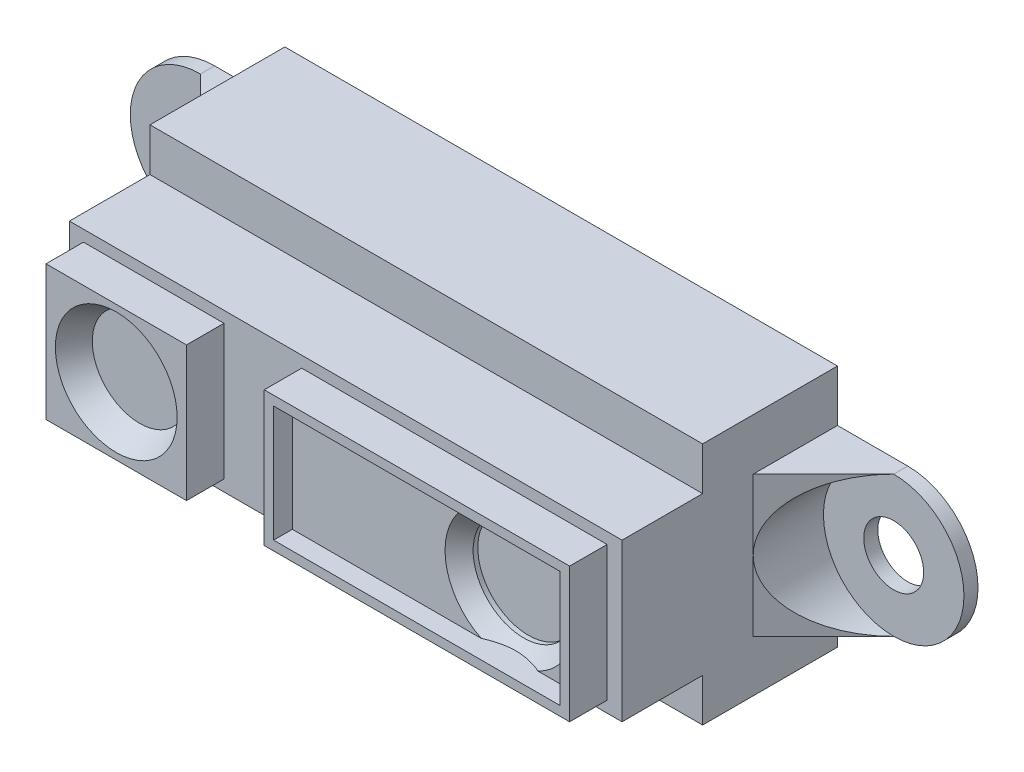
from build123d import *

# Parameters (mm, degrees)
BOSS_EXTRUDE5_DEPTH = 14.75
SKETCH9_W           = 7.5
SKETCH9_H           = 7.2
SKETCH9_W_2         = 16.3
BOSS_EXTRUDE6_DEPTH = 2
SKETCH10_W          = 15.3
SKETCH10_H          = 6.2
CUT_EXTRUDE4_DEPTH  = 1
SKETCH11_R          = 2.5
CUT_EXTRUDE5_DEPTH  = 1.25
BOSS_EXTRUDE7_DEPTH = 4.5
CUT_EXTRUDE7_START  = -7.5
CUT_EXTRUDE7_DEPTH  = 7.5
SKETCH18_R          = 3.75
CUT_EXTRUDE8_DEPTH  = 4.5
SKETCH19_R          = 1.6
CUT_EXTRUDE9_DEPTH  = 4.5
CHAMFER1_SIZE       = 0.75
CHAMFER1_SIZE_2     = 1.299038106
SKETCH13_R          = 2.7
CUT_EXTRUDE6_DEPTH  = 1
CHAMFER2_SIZE       = 0.75
SCALE1_SCALE        = 0.15


# Read off the part's stored shape, not the designer's step: Cut-Extrude7
with BuildPart() as part:
    # Sketch8 → Boss-Extrude5 (new, symmetric)
    with BuildSketch(Plane(origin=(0, 0, 0), x_dir=(0, 0, -1), z_dir=(1, 0, 0))):
        Polygon((0, -6.5), (0, 6.5), (-7.2, 6.5), (-7.2, 4.2), (-11.5, 4.2), (-11.5, -4.2), (-7.2, -4.2), (-7.2, -6.5), align=None)
    extrude(amount=BOSS_EXTRUDE5_DEPTH, both=True)

    # Sketch9 → Boss-Extrude6 (add)
    with BuildSketch(Plane.XY.offset(11.5)):
        with Locations((-10.25, 0)):
            Rectangle(SKETCH9_W, SKETCH9_H)
        with Locations((5.8, 0)):
            Rectangle(SKETCH9_W_2, SKETCH9_H)
    extrude(amount=BOSS_EXTRUDE6_DEPTH)

    # Sketch10 → Cut-Extrude4 (cut)
    with BuildSketch(Plane.XY.offset(13.5)):
        with Locations((5.8, 0)):
            Rectangle(SKETCH10_W, SKETCH10_H)
    extrude(amount=-CUT_EXTRUDE4_DEPTH, mode=Mode.SUBTRACT)

    # Sketch11 → Cut-Extrude5 (cut)
    with BuildSketch(Plane.XY.offset(13.5)):
        with Locations((-10.25, 0)):
            Circle(SKETCH11_R)
    extrude(amount=-CUT_EXTRUDE5_DEPTH, mode=Mode.SUBTRACT)

    # Sketch16 → Boss-Extrude7 (add)
    with BuildSketch(Plane(origin=(0, 0, 0), x_dir=(-1, 0, 0), z_dir=(0, 0, -1))):
        with BuildLine():
            Line((-14.75, -3.75), (-14.75, 3.75))
            Line((-14.75, 3.75), (-18.5, 3.75))
            ThreePointArc((-18.5, 3.75), (-22.25, 0), (-18.5, -3.75))
            Line((-18.5, -3.75), (-14.75, -3.75))
        make_face()
    boss_extrude7 = extrude(amount=-BOSS_EXTRUDE7_DEPTH)

    # Cut-Extrude7 outline → Cut-Extrude7 (cut)
    with BuildSketch(Plane.XZ.offset(3.75).offset(CUT_EXTRUDE7_START)):
        Polygon((14.75, 4.5), (18.5, 0.75), (24, 0.75), (24, 4.5), align=None)
    cut_extrude7 = extrude(amount=CUT_EXTRUDE7_DEPTH, mode=Mode.SUBTRACT)

    # Sketch18 → Cut-Extrude8 (cut)
    with BuildSketch(Plane.XY.offset(0.75)):
        with Locations((18.5, 0)):
            Circle(SKETCH18_R)
    cut_extrude8 = extrude(amount=CUT_EXTRUDE8_DEPTH, mode=Mode.SUBTRACT)

    # Sketch19 → Cut-Extrude9 (cut)
    with BuildSketch(Plane.XY.offset(0.75)):
        with Locations((18.5, 0)):
            Circle(SKETCH19_R)
    cut_extrude9 = extrude(amount=-CUT_EXTRUDE9_DEPTH, mode=Mode.SUBTRACT)

    # Mirror1: Boss-Extrude7, Cut-Extrude7, Cut-Extrude8, Cut-Extrude9 across plane
    add(boss_extrude7.mirror(Plane(origin=(0, 0, 0), x_dir=(0, 0, 1), z_dir=(1, 0, 0))))
    add(cut_extrude7.mirror(Plane(origin=(0, 0, 0), x_dir=(0, 0, 1), z_dir=(1, 0, 0))), mode=Mode.SUBTRACT)
    add(cut_extrude8.mirror(Plane(origin=(0, 0, 0), x_dir=(0, 0, 1), z_dir=(1, 0, 0))), mode=Mode.SUBTRACT)
    add(cut_extrude9.mirror(Plane(origin=(0, 0, 0), x_dir=(0, 0, 1), z_dir=(1, 0, 0))), mode=Mode.SUBTRACT)

    # Chamfer1
    # the kernel refuses this chamfer: 1.299038106, 0.75 mm, written as the material it takes off along each edge
    with BuildSketch(Plane(origin=(-10.25, 0, 13.5), x_dir=(1, 0, 0), z_dir=(0, -1, 0))) as chamfer1_piece_1_section:
        Polygon((2.5 + CHAMFER1_SIZE, 0), (2.5, -CHAMFER1_SIZE_2), (2.5, 0), align=None)
    chamfer1_piece_1 = revolve(axis=Axis((-10.25, 0, 13.5), (0, 0, 1)), mode=Mode.PRIVATE)
    chamfer1_piece_1 = split(chamfer1_piece_1, bisect_by=Plane(origin=(-13.133837987, 0, 12.25), z_dir=(0, 0, 1)), keep=Keep.TOP, mode=Mode.PRIVATE)
    add(chamfer1_piece_1, mode=Mode.SUBTRACT)

    # Sketch13 → Cut-Extrude6 (cut)
    with BuildSketch(Plane.XY.offset(12.5)):
        with Locations((9.75, 0)):
            Circle(SKETCH13_R)
    extrude(amount=-CUT_EXTRUDE6_DEPTH, mode=Mode.SUBTRACT)

    # Chamfer2
    # the kernel refuses this chamfer: 0.75 mm, written as the material it takes off along each edge
    with BuildSketch(Plane(origin=(9.75, 0, 12.5), x_dir=(1, 0, 0), z_dir=(0, -1, 0))) as chamfer2_piece_1_section:
        Polygon((2.7 + CHAMFER2_SIZE, 0), (2.7, -CHAMFER2_SIZE), (2.7, 0), align=None)
    chamfer2_piece_1 = revolve(axis=Axis((9.75, 0, 12.5), (0, 0, 1)), mode=Mode.PRIVATE)
    chamfer2_piece_1 = split(chamfer2_piece_1, bisect_by=Plane(origin=(6.68747717, -3.1, 12.13747717), z_dir=(0, 1, 0)), keep=Keep.TOP, mode=Mode.PRIVATE)
    chamfer2_piece_1 = split(chamfer2_piece_1, bisect_by=Plane(origin=(6.68747717, 3.1, 12.13747717), z_dir=(0, -1, 0)), keep=Keep.TOP, mode=Mode.PRIVATE)
    add(chamfer2_piece_1, mode=Mode.SUBTRACT)


with BuildPart() as part_1:
    # Scale1: scaled about (-0.05599767, 0, 5.421987795)
    add(part.part.scale(SCALE1_SCALE).moved(Location((-0.047598019, 0, 4.608689626))))


solid = part_1.part
